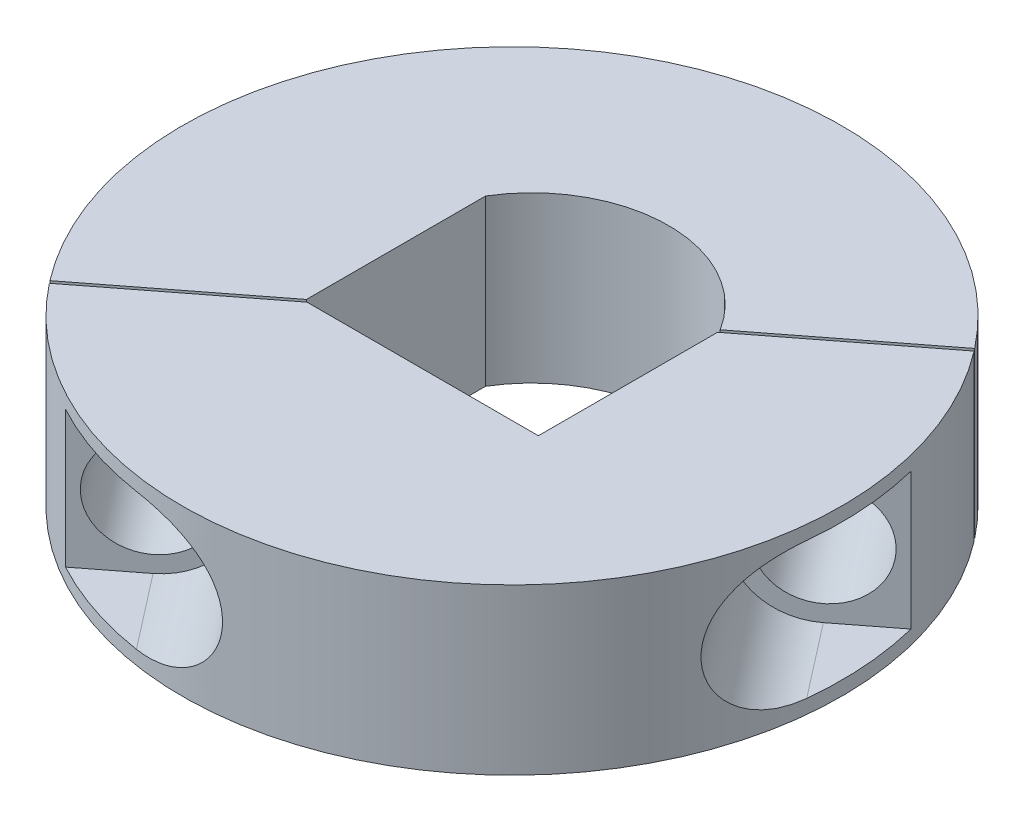
from build123d import *

# Parameters (mm, degrees)
SKETCH1_R               = 25.4
BOSS_EXTRUDE1_DEPTH     = 12.7
CUT_EXTRUDE1_DEPTH      = 39.1
CUT_EXTRUDE5_DEPTH      = 39.1
CUT_EXTRUDE6_DEPTH      = 48.860047437
CUT_EXTRUDE6_DEPTH_BACK = 48.860047437
SKETCH5_R               = 4
CUT_EXTRUDE7_DEPTH      = 48.860047616


with BuildPart() as part:
    # Sketch1 → Boss-Extrude1 (new body)
    with BuildSketch(Plane(origin=(0, 0, 0), x_dir=(1, 0, 0), z_dir=(0, 1, 0))):
        Circle(SKETCH1_R)
    extrude(amount=BOSS_EXTRUDE1_DEPTH)

    # Sketch2 → Cut-Extrude1 (cut, through all)
    with BuildSketch(Plane(origin=(0, 12.7, 0), x_dir=(1, 0, 0), z_dir=(0, 1, 0))):
        with BuildLine():
            Line((-9.017, -6.985), (9.017, -6.985))
            Line((9.017, -6.985), (9.017, 6.985))
            ThreePointArc((9.017, 6.985), (0, 12.065), (-9.017, 6.985))
            Line((-9.017, 6.985), (-9.017, -6.985))
        make_face()
    extrude(amount=-CUT_EXTRUDE1_DEPTH, mode=Mode.SUBTRACT)

    # Sketch4 → Cut-Extrude5 (cut, through all)
    with BuildSketch(Plane(origin=(0, 12.7, 0), x_dir=(1, 0, 0), z_dir=(0, 1, 0))):
        with BuildLine():
            Line((20.001939718, 15.655108033), (-20.157488744, -15.454308381))
            ThreePointArc((-20.157488744, -15.454308381), (-20.079965232, -15.554902645), (-20.001939718, -15.655108033))
            Line((-20.001939718, -15.655108033), (20.157488744, 15.454308381))
            ThreePointArc((20.157488744, 15.454308381), (20.079965232, 15.554902645), (20.001939718, 15.655108033))
        make_face()
    extrude(amount=-CUT_EXTRUDE5_DEPTH, mode=Mode.SUBTRACT)


with BuildPart() as cut_extrude5_piece_1:
    # of the separate pieces the step leaves, piece 1, a body of its own (cut_extrude5_pieces)
    add(part.part.solids().sort_by_distance((-20.001939718, 0, 15.655108033))[0])


with BuildPart() as cut_extrude5_piece_2:
    # of the separate pieces the step leaves, piece 2, a body of its own (cut_extrude5_pieces)
    add(part.part.solids().sort_by_distance((20.001939718, 0, -15.655108033))[0])


with BuildPart() as cut_extrude6_tool:
    # Sketch5 → Cut-Extrude6 (new, two sides: drawn at the far end of the back side and taken through both)
    with BuildSketch(Plane(origin=(6.299735571, 0, 8.132385919), x_dir=(-0.7905498122844318, 0, 0.6123977419104758), z_dir=(-0.6123977419104758, 0, -0.7905498122844318)).offset(-CUT_EXTRUDE6_DEPTH_BACK)):
        with Locations((-18.409741518, 6.35)):
            Circle(SKETCH5_R)
        with Locations((18.409741518, 6.35)):
            Circle(SKETCH5_R)
    extrude(amount=CUT_EXTRUDE6_DEPTH + CUT_EXTRUDE6_DEPTH_BACK)


with BuildPart() as cut_extrude5_piece_1_1:
    add(cut_extrude5_piece_1.part)

    # Cut-Extrude6: cut by cut_extrude6_tool
    add(cut_extrude6_tool.part, mode=Mode.SUBTRACT)

    # Sketch6 → Cut-Extrude7 (cut, through all)
    with BuildSketch(Plane(origin=(6.299735571, 0, 8.132385919), x_dir=(-0.7905498122844318, 0, 0.6123977419104758), z_dir=(-0.6123977419104758, 0, -0.7905498122844318))):
        with BuildLine():
            Line((-18.409741518, 1.08), (-23.223643792, 1.08))
            Line((-23.223643792, 1.08), (-23.223643792, 11.62))
            Line((-23.223643792, 11.62), (-18.409741518, 11.62))
            ThreePointArc((-18.409741518, 11.62), (-13.139741518, 6.35), (-18.409741518, 1.08))
        make_face()
        with BuildLine():
            Line((23.223643792, 1.08), (23.223643792, 11.62))
            Line((23.223643792, 11.62), (18.409741518, 11.62))
            ThreePointArc((18.409741518, 11.62), (13.139741518, 6.35), (18.409741518, 1.08))
            Line((18.409741518, 1.08), (23.223643792, 1.08))
        make_face()
    extrude(amount=-CUT_EXTRUDE7_DEPTH, mode=Mode.SUBTRACT)


with BuildPart() as cut_extrude5_piece_2_1:
    add(cut_extrude5_piece_2.part)

    # Cut-Extrude6: cut by cut_extrude6_tool
    add(cut_extrude6_tool.part, mode=Mode.SUBTRACT)


solid = Compound([cut_extrude5_piece_1_1.part, cut_extrude5_piece_2_1.part])
